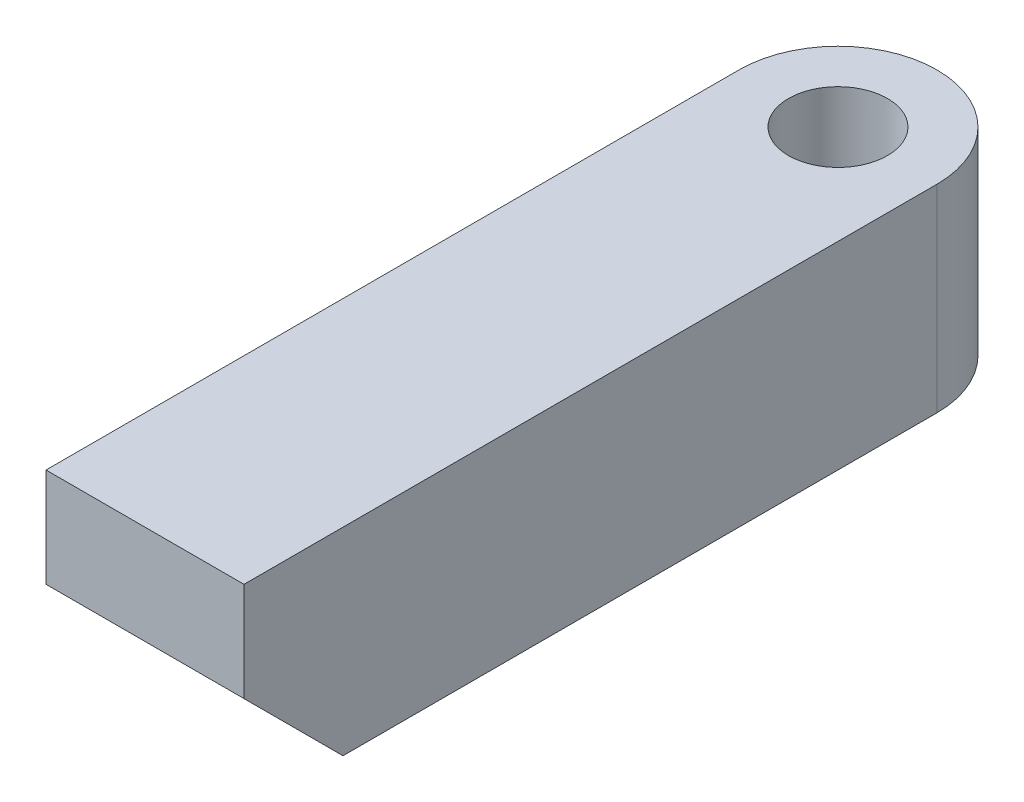
from build123d import *

# Parameters (mm, degrees)
SKETCH1_W             = 10
SKETCH1_H             = 40
BOSS_EXTRUDE1_DEPTH   = 10
F_5_0MM_DOWEL_HOLE1_D = 5
FILLET1_R             = 5
CHAMFER1_SIZE         = 5


with BuildPart() as part:
    # Sketch1 → Boss-Extrude1 (new body)
    with BuildSketch(Plane(origin=(0, 0, 0), x_dir=(1, 0, 0), z_dir=(0, 1, 0))):
        Rectangle(SKETCH1_W, SKETCH1_H)
    extrude(amount=BOSS_EXTRUDE1_DEPTH)

    # Ø5.0mm Dowel Hole1 (through all)
    with Locations(Plane(origin=(0, 10, 0), x_dir=(1, 0, 0), z_dir=(0, 1, 0))):
        with Locations((0, 15)):
            Hole(F_5_0MM_DOWEL_HOLE1_D / 2)

    # Fillet1
    fillet1_edges = [part.edges().sort_by_distance(p)[0] for p in [
        (5, 5, -20),
        (-5, 5, -20),
    ]]
    fillet(fillet1_edges, radius=FILLET1_R - 0.0001)  # a hair under: the kernel refuses the full size

    # Chamfer1
    chamfer1_edges = [part.edges().sort_by_distance(p)[0] for p in [
        (0, 0, 20),
    ]]
    chamfer(chamfer1_edges, length=CHAMFER1_SIZE)


solid = part.part
